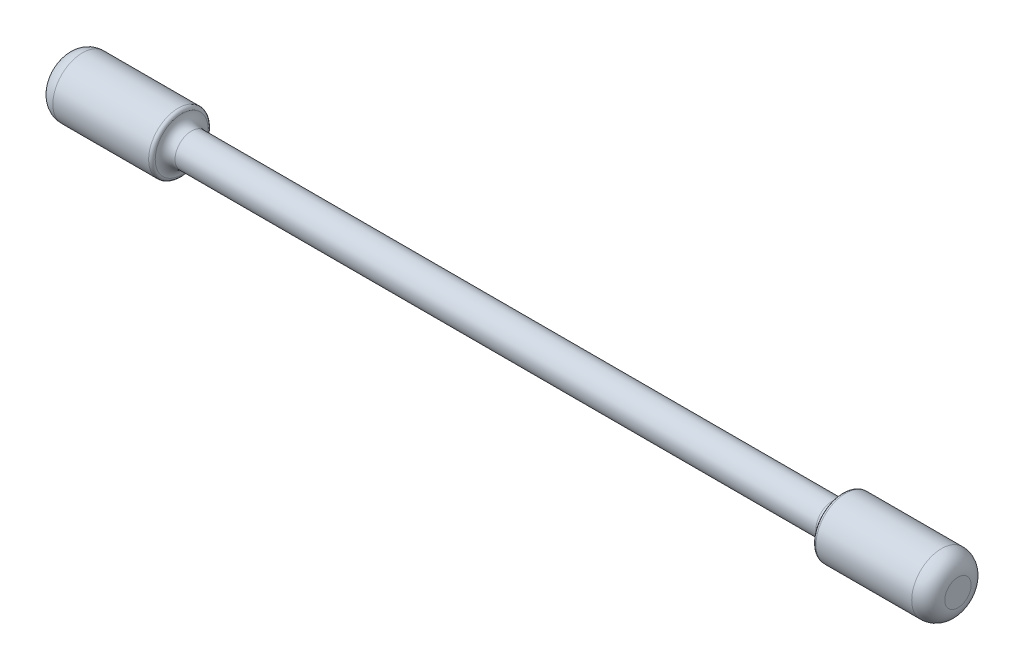
from build123d import *

# Parameters (mm, degrees)
FILLET1_R = 3
FILLET2_R = 1
FILLET3_R = 5


with BuildPart() as part:
    # Sketch1 → Revolve1 (revolve)
    with BuildSketch(Plane(origin=(0, 0, 0), x_dir=(1, 0, 0), z_dir=(0, 1, 0)), mode=Mode.PRIVATE) as revolve1_sk:
        Polygon((135, 0), (-135, 0), (-135, -9), (-100, -9), (-100, -5), (100, -5), (100, -9), (135, -9), align=None)
    revolve(revolve1_sk.sketch.rotate(Axis((135, 0, 0), (-1, 0, 0)), 180), axis=Axis((135, 0, 0), (-1, 0, 0)))

    # Fillet1
    fillet1_edges = [part.edges().sort_by_distance(p)[0] for p in [
        (100, 0, 5),
        (-100, 0, 5),
    ]]
    fillet(fillet1_edges, radius=FILLET1_R)

    # Fillet2
    fillet2_edges = [part.edges().sort_by_distance(p)[0] for p in [
        (100, 0, 9),
        (-100, 0, 9),
    ]]
    fillet(fillet2_edges, radius=FILLET2_R - 0.0001)  # a hair under: the kernel refuses the full size

    # Fillet3
    fillet3_edges = [part.edges().sort_by_distance(p)[0] for p in [
        (-135, 0, 9),
        (135, 0, 9),
    ]]
    fillet(fillet3_edges, radius=FILLET3_R)


solid = part.part
